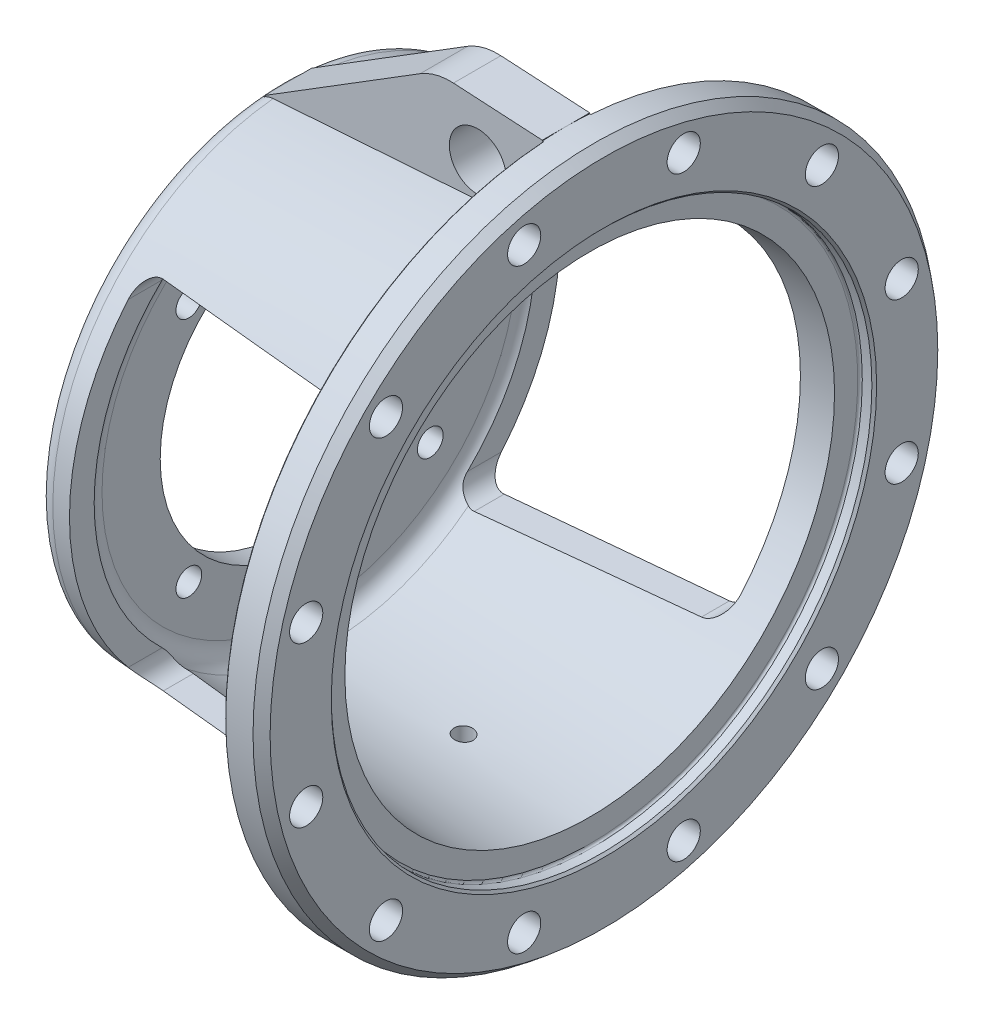
from build123d import *

# Parameters (mm, degrees)
SKETCH3_R               = 133.35
CUT_EXTRUDE1_DEPTH      = 4.7752
CUT_EXTRUDE2_REACH      = 388.957
SKETCH4_R               = 100.0125
SKETCH5_R               = 180.97627
CUT_EXTRUDE3_DEPTH      = 9.525
CUT_EXTRUDE4_REACH      = 388.957
SKETCH6_R               = 8.636
CIRPATTERN1_COUNT       = 4
CUT_EXTRUDE5_REACH      = 391.601
SKETCH7_R               = 11.1125
CIRPATTERN2_COUNT       = 12
BOSS_EXTRUDE1_DEPTH     = 15.875
CUT_EXTRUDE6_REACH      = 403.103
SKETCH9_R               = 19.05
CUT_EXTRUDE7_REACH      = 393.629
SKETCH10_R              = 6.35
CUT_EXTRUDE8_DEPTH      = 392.629265229
CUT_EXTRUDE8_DEPTH_BACK = 392.629265229
CHAMFER1_SIZE           = 1.5875
CHAMFER2_SIZE           = 0.79375
FILLET1_R               = 1.524
CHAMFER3_SIZE           = 5.08
CHAMFER3_SIZE2          = 6.35


with BuildPart() as part:
    # Sketch2 → Revolve1 (revolve)
    with BuildSketch(Plane.XY):
        with BuildLine():
            Line((0, 0), (0, 150.729136562))
            ThreePointArc((0, 150.729136562), (3.411807989, 159.390515734), (11.814092783, 163.3982))
            Line((11.814092783, 163.3982), (180.209907217, 175.173582448))
            ThreePointArc((180.209907217, 175.173582448), (188.612192011, 179.181266713), (192.024, 187.842645886))
            Line((192.024, 187.842645886), (192.024, 228.6))
            Line((192.024, 228.6), (217.424, 228.6))
            Line((217.424, 228.6), (217.424, 180.975))
            Line((217.424, 180.975), (207.899, 180.975))
            Line((207.899, 180.975), (207.899, 163.926903472))
            Line((207.899, 163.926903472), (32.159492783, 151.638))
            ThreePointArc((32.159492783, 151.638), (23.757207989, 147.630315734), (20.3454, 138.968936562))
            Line((20.3454, 138.968936562), (20.3454, 0))
            Line((20.3454, 0), (0, 0))
        make_face()
    revolve(axis=Axis((0, 0, 0), (1, 0, 0)))

    # Sketch3 → Cut-Extrude1 (cut)
    with BuildSketch(Plane.ZY):
        Circle(SKETCH3_R)
    extrude(amount=-CUT_EXTRUDE1_DEPTH, mode=Mode.SUBTRACT)

    # Sketch4 → Cut-Extrude2 (cut, up to next)
    with BuildSketch(Plane.ZY.offset(-4.7752), mode=Mode.PRIVATE) as cut_extrude2_sk1:
        Circle(SKETCH4_R)
    cut_extrude2_tool1 = extrude(cut_extrude2_sk1.sketch, amount=-CUT_EXTRUDE2_REACH, mode=Mode.PRIVATE) & part.part
    add(cut_extrude2_tool1.solids().sort_by_distance((4.7752, 0, 0))[0], mode=Mode.SUBTRACT)

    # Sketch5 → Cut-Extrude3 (cut)
    with BuildSketch(Plane(origin=(217.424, 0, 0), x_dir=(0, 0, -1), z_dir=(1, 0, 0))):
        Circle(SKETCH5_R)
    extrude(amount=-CUT_EXTRUDE3_DEPTH, mode=Mode.SUBTRACT)

    # Sketch6 → Cut-Extrude4 (cut, up to next)
    with BuildSketch(Plane.ZY.offset(-4.7752), mode=Mode.PRIVATE) as cut_extrude4_sk1:
        with Locations((80.82230509, 80.82230509)):
            Circle(SKETCH6_R)
    cut_extrude4_tool1 = extrude(cut_extrude4_sk1.sketch, amount=-CUT_EXTRUDE4_REACH, mode=Mode.PRIVATE) & part.part
    cut_extrude4 = cut_extrude4_tool1.solids().sort_by_distance((4.7752, 80.822305, 80.822305))[0]
    add(cut_extrude4, mode=Mode.SUBTRACT)

    # CirPattern1: Cut-Extrude4 ×4 about axis
    cirpattern1_axis = Axis((4.7752, 0, 0), (-1, 0, 0))
    for i in range(1, CIRPATTERN1_COUNT):
        add(cut_extrude4.rotate(cirpattern1_axis, i * 360 / CIRPATTERN1_COUNT), mode=Mode.SUBTRACT)

    # Sketch7 → Cut-Extrude5 (cut, up to next)
    with BuildSketch(Plane(origin=(217.424, 0, 0), x_dir=(0, 0, -1), z_dir=(1, 0, 0)), mode=Mode.PRIVATE) as cut_extrude5_sk1:
        with Locations((199.3429424, 53.413780433)):
            Circle(SKETCH7_R)
    cut_extrude5_tool1 = extrude(cut_extrude5_sk1.sketch, amount=-CUT_EXTRUDE5_REACH, mode=Mode.PRIVATE) & part.part
    cut_extrude5 = cut_extrude5_tool1.solids().sort_by_distance((217.424, 53.41378, -199.342942))[0]
    add(cut_extrude5, mode=Mode.SUBTRACT)

    # CirPattern2: Cut-Extrude5 ×12 about axis
    cirpattern2_axis = Axis((217.424, 0, 0), (-1, 0, 0))
    for i in range(1, CIRPATTERN2_COUNT):
        add(cut_extrude5.rotate(cirpattern2_axis, i * 360 / CIRPATTERN2_COUNT), mode=Mode.SUBTRACT)

    # Sketch8 → Boss-Extrude1 (add, symmetric)
    with BuildSketch(Plane.XY):
        with BuildLine():
            Line((192.024, 173.460953796), (192.024, 228.6))
            Line((192.024, 228.6), (132.538836408, 231.9782))
            ThreePointArc((132.538836408, 231.9782), (120.967207489, 230.858806132), (110.271848346, 226.301950716))
            Line((110.271848346, 226.301950716), (5.987343994, 161.510149934))
            Line((5.987343994, 161.510149934), (5.448843156, 158.54562766))
            Line((5.448843156, 158.54562766), (192.024, 173.460953796))
        make_face()
    extrude(amount=BOSS_EXTRUDE1_DEPTH, both=True)

    # Sketch9 → Cut-Extrude6 (cut, up to next)
    with BuildSketch(Plane.XY.offset(15.875), mode=Mode.PRIVATE) as cut_extrude6_sk1:
        with Locations((148.844, 194.564)):
            Circle(SKETCH9_R)
    cut_extrude6_tool1 = extrude(cut_extrude6_sk1.sketch, amount=-CUT_EXTRUDE6_REACH, mode=Mode.PRIVATE) & part.part
    add(cut_extrude6_tool1.solids().sort_by_distance((148.844, 194.564, 15.875))[0], mode=Mode.SUBTRACT)

    # Sketch10 → Cut-Extrude7 (cut, up to next)
    with BuildSketch(Plane(origin=(0, 0, 0), x_dir=(1, 0, 0), z_dir=(0, 1, 0)), mode=Mode.PRIVATE) as cut_extrude7_sk1:
        with Locations((123.444, 0)):
            Circle(SKETCH10_R)
    cut_extrude7_tool1 = extrude(cut_extrude7_sk1.sketch, amount=-CUT_EXTRUDE7_REACH, mode=Mode.PRIVATE) & part.part
    add(cut_extrude7_tool1.solids().sort_by_distance((123.444, 0, 0))[0], mode=Mode.SUBTRACT)

    # Sketch11 → Cut-Extrude8 (cut, two sides: drawn at the far end of the back side and taken through both)
    with BuildSketch(Plane.XY.offset(-CUT_EXTRUDE8_DEPTH_BACK)):
        with BuildLine():
            Line((36.5252, -119.3419), (173.8376, -119.3419))
            ThreePointArc((173.8376, -119.3419), (182.817856121, -115.622156121), (186.5376, -106.6419))
            Line((186.5376, -106.6419), (186.5376, 106.6419))
            ThreePointArc((186.5376, 106.6419), (182.817856121, 115.622156121), (173.8376, 119.3419))
            Line((173.8376, 119.3419), (36.5252, 119.3419))
            ThreePointArc((36.5252, 119.3419), (27.544943879, 115.622156121), (23.8252, 106.6419))
            Line((23.8252, 106.6419), (23.8252, -106.6419))
            ThreePointArc((23.8252, -106.6419), (27.544943879, -115.622156121), (36.5252, -119.3419))
        make_face()
    extrude(amount=CUT_EXTRUDE8_DEPTH + CUT_EXTRUDE8_DEPTH_BACK, mode=Mode.SUBTRACT)

    # Chamfer1
    chamfer1_edges = [part.edges().sort_by_distance(p)[0] for p in [
        (217.424, 0, 180.97627),
    ]]
    chamfer(chamfer1_edges, length=CHAMFER1_SIZE)

    # Chamfer2
    chamfer2_edges = [part.edges().sort_by_distance(p)[0] for p in [
        (192.024, -228.6, 0),
    ]]
    chamfer(chamfer2_edges, length=CHAMFER2_SIZE)

    # Fillet1
    fillet1_edges = [part.edges().sort_by_distance(p)[0] for p in [
        (207.899, 0, 180.97627),
    ]]
    fillet(fillet1_edges, radius=FILLET1_R)

    # Chamfer3
    chamfer3_edges = [part.edges().sort_by_distance(p)[0] for p in [
        (217.424, -228.6, 0),
    ]]
    chamfer3_side = [part.faces().sort_by_distance(p)[0] for p in [
        (217.424, 0, 189.029554407),
    ]]
    chamfer(chamfer3_edges, length=CHAMFER3_SIZE, length2=CHAMFER3_SIZE2, reference=chamfer3_side[0])


solid = part.part
